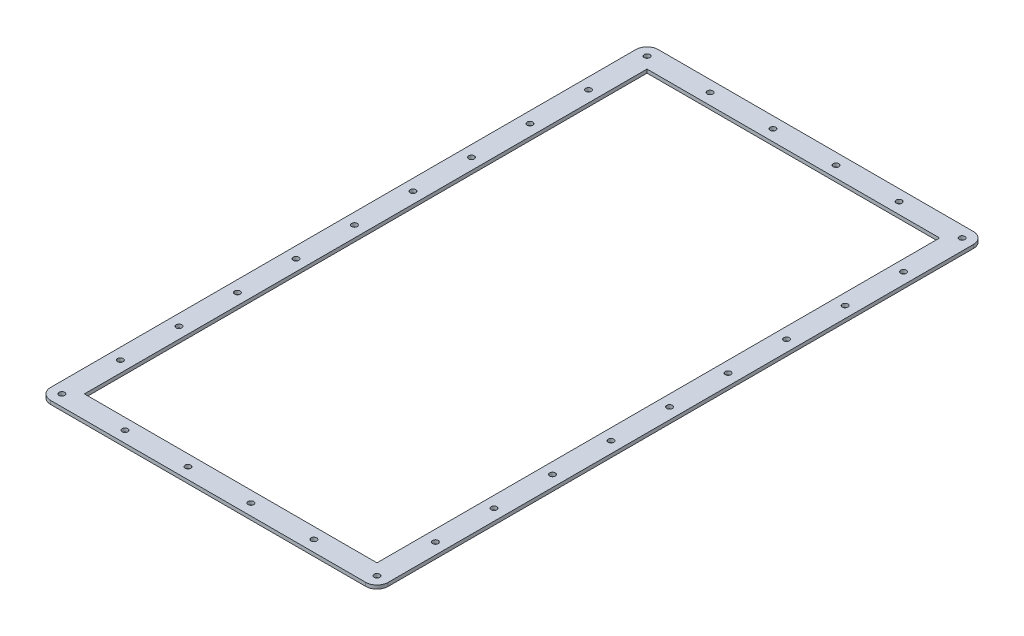
from build123d import *

# Parameters (mm, degrees)
SKETCH1_W           = 300
SKETCH1_H           = 540
SKETCH1_R           = 2.5
SKETCH1_W_2         = 260
SKETCH1_H_2         = 500
BOSS_EXTRUDE1_DEPTH = 3.175
FILLET1_R           = 10


with BuildPart() as part:
    # Sketch1 → Boss-Extrude1 (new body)
    with BuildSketch(Plane(origin=(0, 0, 0), x_dir=(1, 0, 0), z_dir=(0, 1, 0))):
        Rectangle(SKETCH1_W, SKETCH1_H)
        with Locations((-140, -260)):
            Circle(SKETCH1_R, mode=Mode.SUBTRACT)
        with Locations((-140, -208)):
            Circle(SKETCH1_R, mode=Mode.SUBTRACT)
        with Locations((-84, -260)):
            Circle(SKETCH1_R, mode=Mode.SUBTRACT)
        with Locations((-140, -156)):
            Circle(SKETCH1_R, mode=Mode.SUBTRACT)
        with Locations((-28, -260)):
            Circle(SKETCH1_R, mode=Mode.SUBTRACT)
        with Locations((-140, -104)):
            Circle(SKETCH1_R, mode=Mode.SUBTRACT)
        with Locations((-140, -52)):
            Circle(SKETCH1_R, mode=Mode.SUBTRACT)
        with Locations((-140, 0)):
            Circle(SKETCH1_R, mode=Mode.SUBTRACT)
        with Locations((28, -260)):
            Circle(SKETCH1_R, mode=Mode.SUBTRACT)
        with Locations((84, -260)):
            Circle(SKETCH1_R, mode=Mode.SUBTRACT)
        with Locations((140, -260)):
            Circle(SKETCH1_R, mode=Mode.SUBTRACT)
        with Locations((140, -208)):
            Circle(SKETCH1_R, mode=Mode.SUBTRACT)
        with Locations((140, -156)):
            Circle(SKETCH1_R, mode=Mode.SUBTRACT)
        with Locations((140, -104)):
            Circle(SKETCH1_R, mode=Mode.SUBTRACT)
        with Locations((140, -52)):
            Circle(SKETCH1_R, mode=Mode.SUBTRACT)
        with Locations((140, 0)):
            Circle(SKETCH1_R, mode=Mode.SUBTRACT)
        with Locations((-140, 52)):
            Circle(SKETCH1_R, mode=Mode.SUBTRACT)
        with Locations((-140, 104)):
            Circle(SKETCH1_R, mode=Mode.SUBTRACT)
        with Locations((-140, 156)):
            Circle(SKETCH1_R, mode=Mode.SUBTRACT)
        with Locations((-140, 208)):
            Circle(SKETCH1_R, mode=Mode.SUBTRACT)
        with Locations((-140, 260)):
            Circle(SKETCH1_R, mode=Mode.SUBTRACT)
        with Locations((-84, 260)):
            Circle(SKETCH1_R, mode=Mode.SUBTRACT)
        with Locations((-28, 260)):
            Circle(SKETCH1_R, mode=Mode.SUBTRACT)
        Rectangle(SKETCH1_W_2, SKETCH1_H_2, mode=Mode.SUBTRACT)
        with Locations((140, 52)):
            Circle(SKETCH1_R, mode=Mode.SUBTRACT)
        with Locations((140, 104)):
            Circle(SKETCH1_R, mode=Mode.SUBTRACT)
        with Locations((28, 260)):
            Circle(SKETCH1_R, mode=Mode.SUBTRACT)
        with Locations((140, 156)):
            Circle(SKETCH1_R, mode=Mode.SUBTRACT)
        with Locations((84, 260)):
            Circle(SKETCH1_R, mode=Mode.SUBTRACT)
        with Locations((140, 208)):
            Circle(SKETCH1_R, mode=Mode.SUBTRACT)
        with Locations((140, 260)):
            Circle(SKETCH1_R, mode=Mode.SUBTRACT)
    extrude(amount=BOSS_EXTRUDE1_DEPTH)

    # Fillet1
    fillet1_edges = [part.edges().sort_by_distance(p)[0] for p in [
        (150, 1.5875, 270),
        (-150, 1.5875, 270),
        (150, 1.5875, -270),
        (-150, 1.5875, -270),
    ]]
    fillet(fillet1_edges, radius=FILLET1_R)


solid = part.part
